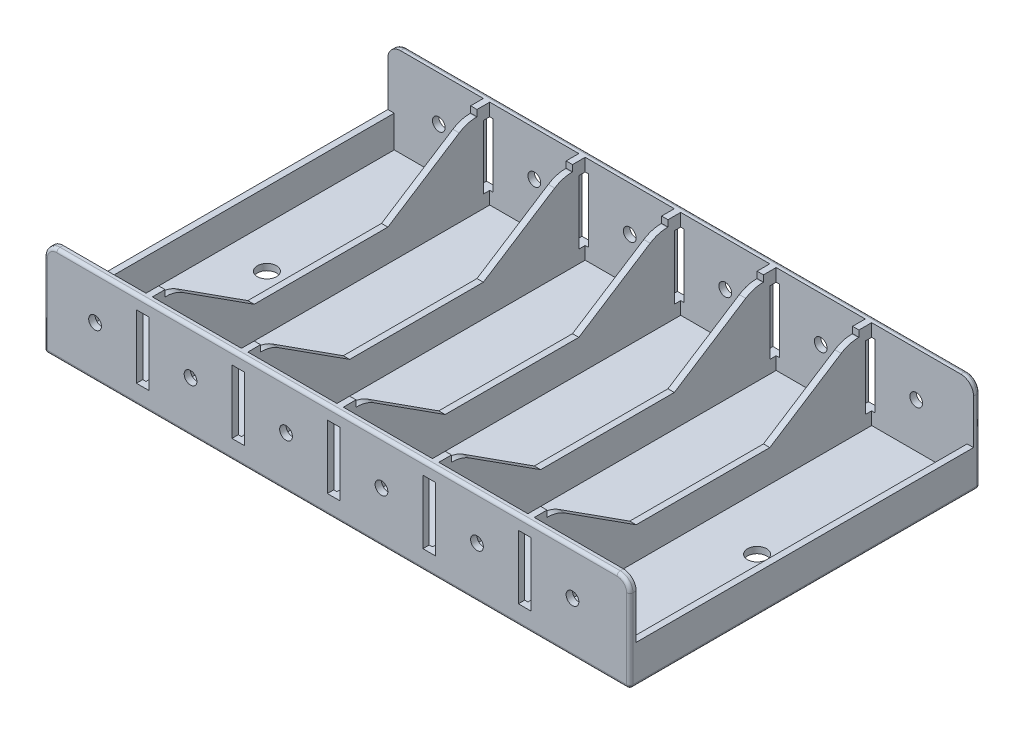
from build123d import *

# Parameters (mm, degrees)
SKETCH1_W               = 92
SKETCH1_H               = 55
BOSS_EXTRUDE1_DEPTH     = 15
SKETCH2_W               = 90
SKETCH2_H               = 53
CUT_EXTRUDE1_DEPTH      = 14
SKETCH3_W               = 1
SKETCH3_H               = 53
BOSS_EXTRUDE2_DEPTH     = 14
CUT_EXTRUDE2_DEPTH      = 96.807097858
CUT_EXTRUDE2_DEPTH_BACK = 96.807097858
SKETCH6_W               = 1
SKETCH6_H               = 53
CUT_EXTRUDE3_DEPTH      = 108.563934476
FILLET1_R               = 0.5
SKETCH7_R               = 1.5
CUT_EXTRUDE4_DEPTH      = 1
SKETCH8_W               = 2
SKETCH8_H               = 10
CUT_EXTRUDE6_DEPTH      = 2
LPATTERN2_COUNT         = 5
LPATTERN2_PITCH         = 15
MIRROR2_COPY_1_SKETCH_W = 2
MIRROR2_COPY_1_SKETCH_H = 10
MIRROR2_COPY_1_DEPTH    = 2
MIRROR2_COPY_2_SKETCH_W = 2
MIRROR2_COPY_2_SKETCH_H = 10
MIRROR2_COPY_2_DEPTH    = 2
MIRROR2_COPY_3_SKETCH_W = 2
MIRROR2_COPY_3_SKETCH_H = 10
MIRROR2_COPY_3_DEPTH    = 2
MIRROR2_COPY_4_SKETCH_W = 2
MIRROR2_COPY_4_SKETCH_H = 10
MIRROR2_COPY_4_DEPTH    = 2
SKETCH9_W               = 70
SKETCH9_H               = 2
CUT_EXTRUDE7_DEPTH      = 0.5
SKETCH10_R              = 1
CUT_EXTRUDE8_DEPTH      = 109.231233939
FILLET2_R               = 2
SKETCH11_W              = 49
SKETCH11_H              = 1
CUT_EXTRUDE9_DEPTH      = 96.005263012
FILLET3_R               = 5


with BuildPart() as part:
    # Sketch1 → Boss-Extrude1 (new body)
    with BuildSketch(Plane(origin=(0, 0, 0), x_dir=(1, 0, 0), z_dir=(0, 1, 0))):
        with Locations((46, 27.5)):
            Rectangle(SKETCH1_W, SKETCH1_H)
    extrude(amount=BOSS_EXTRUDE1_DEPTH)

    # Sketch2 → Cut-Extrude1 (cut)
    with BuildSketch(Plane(origin=(0, 15, 0), x_dir=(1, 0, 0), z_dir=(0, 1, 0))):
        with Locations((46, 27.5)):
            Rectangle(SKETCH2_W, SKETCH2_H)
    extrude(amount=-CUT_EXTRUDE1_DEPTH, mode=Mode.SUBTRACT)

    # Sketch3 → Boss-Extrude2 (add)
    with BuildSketch(Plane(origin=(0, 1, 0), x_dir=(1, 0, 0), z_dir=(0, 1, 0))):
        with Locations((15.5, 27.5)):
            Rectangle(SKETCH3_W, SKETCH3_H)
        with Locations((30.5, 27.5)):
            Rectangle(SKETCH3_W, SKETCH3_H)
        with Locations((45.5, 27.5)):
            Rectangle(SKETCH3_W, SKETCH3_H)
        with Locations((60.5, 27.5)):
            Rectangle(SKETCH3_W, SKETCH3_H)
        with Locations((75.5, 27.5)):
            Rectangle(SKETCH3_W, SKETCH3_H)
    extrude(amount=BOSS_EXTRUDE2_DEPTH)

    # Sketch4 → Cut-Extrude2 (cut, two sides: drawn at the far end of the back side and taken through both)
    with BuildSketch(Plane.ZY.offset(-15).offset(-CUT_EXTRUDE2_DEPTH_BACK)):
        Polygon((-27.5, 15), (-52, 15), (-38, 6), (-27.5, 6), align=None)
        Polygon((-3, 15), (-27.5, 15), (-27.5, 6), (-17, 6), align=None)
    extrude(amount=CUT_EXTRUDE2_DEPTH + CUT_EXTRUDE2_DEPTH_BACK, mode=Mode.SUBTRACT)

    # Sketch6 → Cut-Extrude3 (cut, through all)
    with BuildSketch(Plane(origin=(0, 6, 0), x_dir=(1, 0, 0), z_dir=(0, 1, 0))):
        with Locations((0.5, 27.5)):
            Rectangle(SKETCH6_W, SKETCH6_H)
        with Locations((91.5, 27.5)):
            Rectangle(SKETCH6_W, SKETCH6_H)
    extrude(amount=CUT_EXTRUDE3_DEPTH, mode=Mode.SUBTRACT)

    # Fillet1
    fillet1_edges = [part.edges().sort_by_distance(p)[0] for p in [
        (46, 15, -55),
        (46, 0, -55),
        (92, 0, -27.5),
        (46, 0, 0),
        (0, 0, -27.5),
        (46, 15, 0),
        (0, 7.5, -55),
        (92, 7.5, -55),
        (92, 7.5, 0),
        (0, 7.5, 0),
    ]]
    fillet(fillet1_edges, radius=FILLET1_R)

    # Sketch7 → Cut-Extrude4 (cut)
    with BuildSketch(Plane(origin=(0, 1, 0), x_dir=(1, 0, 0), z_dir=(0, 1, 0))):
        with Locations(Location((7.5, 27.5, 0), (0, 0, 270))):
            Circle(SKETCH7_R)
        with Locations(Location((84.5, 27.5, 0), (0, 0, 90))):
            Circle(SKETCH7_R)
    extrude(amount=-CUT_EXTRUDE4_DEPTH, mode=Mode.SUBTRACT)

    # Sketch8 → Cut-Extrude6 (cut)
    with BuildSketch(Plane.XY):
        with Locations((15.5, 8)):
            Rectangle(SKETCH8_W, SKETCH8_H)
    cut_extrude6 = extrude(amount=-CUT_EXTRUDE6_DEPTH, mode=Mode.SUBTRACT)

    # LPattern2: Cut-Extrude6 ×5
    with Locations(*[(i * LPATTERN2_PITCH, 0, 0) for i in range(1, LPATTERN2_COUNT)]):
        add(cut_extrude6, mode=Mode.SUBTRACT)

    # Mirror2: Cut-Extrude6 across plane
    add(cut_extrude6.mirror(Plane.XY.offset(-27.5)), mode=Mode.SUBTRACT)

    # Mirror2 copy 1 sketch → Mirror2 copy 1 (cut)
    with BuildSketch(Plane(origin=(15, 0, -55), x_dir=(1, 0, 0), z_dir=(0, 0, -1))):
        with Locations((15.5, -8)):
            Rectangle(MIRROR2_COPY_1_SKETCH_W, MIRROR2_COPY_1_SKETCH_H)
    extrude(amount=-MIRROR2_COPY_1_DEPTH, mode=Mode.SUBTRACT)

    # Mirror2 copy 2 sketch → Mirror2 copy 2 (cut)
    with BuildSketch(Plane(origin=(30, 0, -55), x_dir=(1, 0, 0), z_dir=(0, 0, -1))):
        with Locations((15.5, -8)):
            Rectangle(MIRROR2_COPY_2_SKETCH_W, MIRROR2_COPY_2_SKETCH_H)
    extrude(amount=-MIRROR2_COPY_2_DEPTH, mode=Mode.SUBTRACT)

    # Mirror2 copy 3 sketch → Mirror2 copy 3 (cut)
    with BuildSketch(Plane(origin=(45, 0, -55), x_dir=(1, 0, 0), z_dir=(0, 0, -1))):
        with Locations((15.5, -8)):
            Rectangle(MIRROR2_COPY_3_SKETCH_W, MIRROR2_COPY_3_SKETCH_H)
    extrude(amount=-MIRROR2_COPY_3_DEPTH, mode=Mode.SUBTRACT)

    # Mirror2 copy 4 sketch → Mirror2 copy 4 (cut)
    with BuildSketch(Plane(origin=(60, 0, -55), x_dir=(1, 0, 0), z_dir=(0, 0, -1))):
        with Locations((15.5, -8)):
            Rectangle(MIRROR2_COPY_4_SKETCH_W, MIRROR2_COPY_4_SKETCH_H)
    extrude(amount=-MIRROR2_COPY_4_DEPTH, mode=Mode.SUBTRACT)

    # Sketch9 → Cut-Extrude7 (cut)
    with BuildSketch(Plane.XZ):
        with Locations((55.5, -2.5)):
            Rectangle(SKETCH9_W, SKETCH9_H)
    extrude(amount=-CUT_EXTRUDE7_DEPTH, mode=Mode.SUBTRACT)

    # Sketch10 → Cut-Extrude8 (cut, through all)
    with BuildSketch(Plane.XY):
        with Locations((23, 8)):
            Circle(SKETCH10_R)
        with Locations((38, 8)):
            Circle(SKETCH10_R)
        with Locations((53, 8)):
            Circle(SKETCH10_R)
        with Locations((68, 8)):
            Circle(SKETCH10_R)
        with Locations((83, 8)):
            Circle(SKETCH10_R)
        with Locations((8, 8)):
            Circle(SKETCH10_R)
    extrude(amount=-CUT_EXTRUDE8_DEPTH, mode=Mode.SUBTRACT)

    # Fillet2
    # the kernel refuses this fillet: 2 mm, written as the material it takes off along each edge
    with BuildSketch(Plane(origin=(2, 13, 0), x_dir=(0, 1, 0), z_dir=(1, 0, 0))) as fillet2_piece_1:
        with BuildLine():
            CenterArc((1.5, -0.5), 0.5, 0, 90)
            Line((2, -0.5), (2, 0))
            Line((2, 0), (1.5, 0))
        make_face()
    revolve(axis=Axis((2, 13, 0), (0, 0, 1)), revolution_arc=90, mode=Mode.SUBTRACT)
    with BuildSketch(Plane(origin=(90, 13, 0), x_dir=(1, 0, 0), z_dir=(0, -1, 0))) as fillet2_piece_2:
        with BuildLine():
            CenterArc((1.5, -0.5), 0.5, 0, 90)
            Line((2, -0.5), (2, 0))
            Line((2, 0), (1.5, 0))
        make_face()
    revolve(axis=Axis((90, 13, 0), (0, 0, 1)), revolution_arc=90, mode=Mode.SUBTRACT)
    with BuildSketch(Plane(origin=(2, 13, -55), x_dir=(-1, 0, 0), z_dir=(0, -1, 0))) as fillet2_piece_3:
        with BuildLine():
            CenterArc((1.5, -0.5), 0.5, 0, 90)
            Line((2, -0.5), (2, 0))
            Line((2, 0), (1.5, 0))
        make_face()
    revolve(axis=Axis((2, 13, -55), (0, 0, -1)), revolution_arc=90, mode=Mode.SUBTRACT)
    with BuildSketch(Plane(origin=(90, 13, -55), x_dir=(0, 1, 0), z_dir=(-1, 0, 0))) as fillet2_piece_4:
        with BuildLine():
            CenterArc((1.5, -0.5), 0.5, 0, 90)
            Line((2, -0.5), (2, 0))
            Line((2, 0), (1.5, 0))
        make_face()
    revolve(axis=Axis((90, 13, -55), (0, 0, -1)), revolution_arc=90, mode=Mode.SUBTRACT)
    with BuildSketch(Plane(origin=(0, 15, -6), x_dir=(0, -1, 0), z_dir=(0, 0, 1)), Plane(origin=(92, 15, -49), x_dir=(0, -1, 0), z_dir=(0, 0, -1)), Plane(origin=(92, 15, 0), x_dir=(0, -1, 0), z_dir=(0, 0, -1)), Plane(origin=(0, 15, -55), x_dir=(0, -1, 0), z_dir=(0, 0, 1))) as fillet2_piece_5:
        with BuildLine():
            CenterArc((FILLET2_R, FILLET2_R), FILLET2_R, 180, 90)
            Line((0, FILLET2_R), (0, 0))
            Line((0, 0), (FILLET2_R, 0))
        make_face()
    extrude(amount=6, mode=Mode.SUBTRACT)

    # Sketch11 → Cut-Extrude9 (cut, through all)
    with BuildSketch(Plane(origin=(76, 0, 0), x_dir=(0, 0, -1), z_dir=(1, 0, 0))):
        with Locations((27.5, 14.5)):
            Rectangle(SKETCH11_W, SKETCH11_H)
    extrude(amount=-CUT_EXTRUDE9_DEPTH, mode=Mode.SUBTRACT)

    # Fillet3
    fillet3_edges = [part.edges().sort_by_distance(p)[0] for p in [
        (15.5, 14, -50.444444444),
        (75.5, 14, -50.444444444),
        (60.5, 14, -50.444444444),
        (45.5, 14, -50.444444444),
        (30.5, 14, -50.444444444),
        (60.5, 14, -4.555555556),
        (45.5, 14, -4.555555556),
        (30.5, 14, -4.555555556),
        (15.5, 14, -4.555555556),
        (75.5, 14, -4.555555556),
    ]]
    fillet(fillet3_edges, radius=FILLET3_R)


solid = part.part
